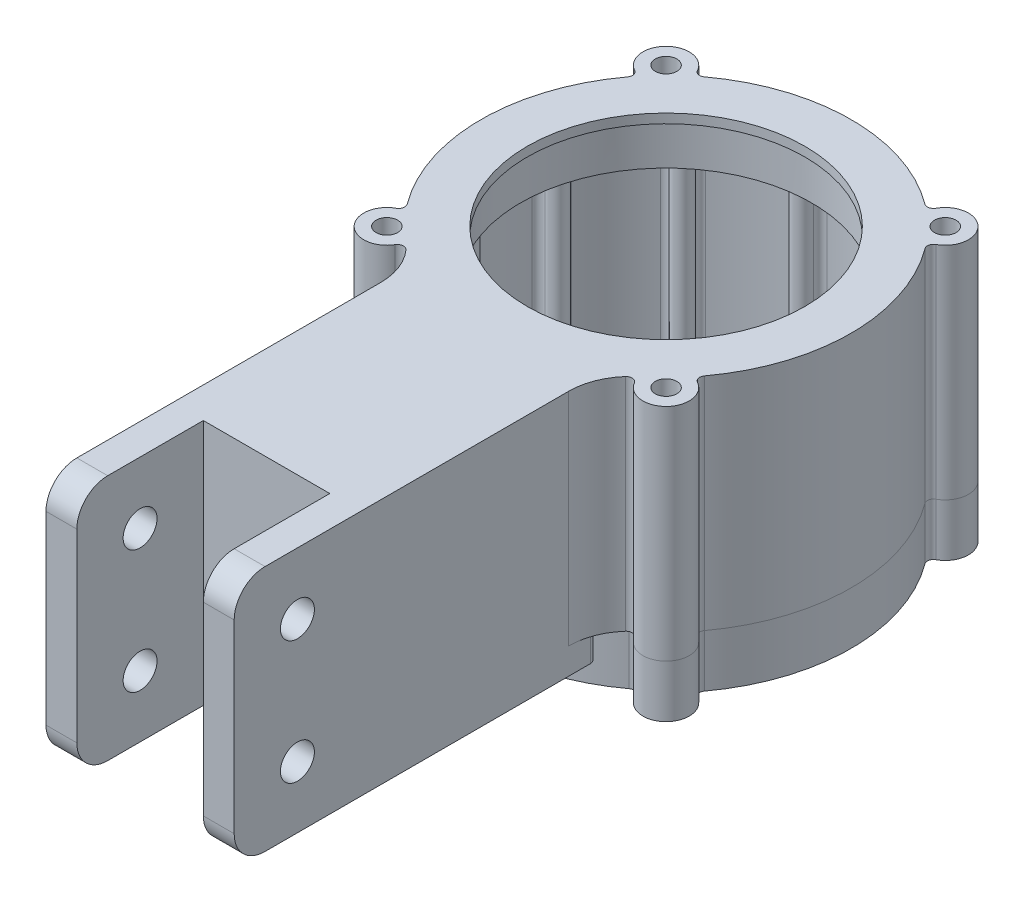
from build123d import *

# Parameters (mm, degrees)
BOSS_EXTRUDE1_DEPTH      = 13.625
BOSS_EXTRUDE2_START      = 8.5
SKETCH2_R                = 30
SKETCH2_R_2              = 22.5
BOSS_EXTRUDE2_DEPTH      = 8.5
CIRPATTERN1_COUNT        = 11
CUT_EXTRUDE1_START       = 1.5
SKETCH3_R                = 23.6
CUT_EXTRUDE1_DEPTH       = 54.980289293
BOSS_EXTRUDE3_DEPTH      = 40
FILLET1_R                = 10
FILLET2_R                = 1
CUT_EXTRUDE2_DEPTH       = 100.018385288
CUT_EXTRUDE2_DEPTH_BACK  = 100.018385288
SKETCH5_R                = 2.75
FILLET3_R                = 5
BOSS_EXTRUDE4_START      = -35.75
SKETCH6_R                = 1.75
SKETCH6_R_2              = 27.462630885
BOSS_EXTRUDE4_DEPTH      = 35.75
SKETCH7_R                = 1.75
SKETCH7_R_2              = 23.6
BOSS_EXTRUDE5_DEPTH      = 8.5
BOSS_EXTRUDE6_START      = -1.5
SKETCH8_R                = 23.6
SKETCH8_R_2              = 22.5
BOSS_EXTRUDE6_DEPTH      = 1.5
BOSS_EXTRUDE7_DEPTH      = 2.85598
BOSS_EXTRUDE7_DEPTH_BACK = 2
SKETCH9_R                = 5
SKETCH9_R_2              = 2.35
SKETCH10_R               = 2.35
CUT_EXTRUDE3_DEPTH       = 4
SKETCH11_R               = 5
BOSS_EXTRUDE8_DEPTH      = 0.85598
CHAMFER1_SIZE            = 6
SKETCH12_R               = 5.5
CUT_EXTRUDE4_DEPTH       = 3.75
CUT_EXTRUDE5_START       = -3
CUT_EXTRUDE5_DEPTH       = 3


with BuildPart() as part:
    # Sketch1 → Boss-Extrude1 (new, symmetric)
    with BuildSketch(Plane(origin=(0, 0, 0), x_dir=(1, 0, 0), z_dir=(0, 1, 0))):
        with BuildLine():
            Line((26.350201371, 7.737117217), (28.784789208, 8.451976705))
            ThreePointArc((28.784789208, 8.451976705), (30, 0), (28.784789208, -8.451976705))
            Line((28.784789208, -8.451976705), (26.350201371, -7.737117217))
            ThreePointArc((26.350201371, -7.737117217), (26.970240942, -5.177083988), (27.34216806, -2.569424229))
            ThreePointArc((27.34216806, -2.569424229), (27.037439323, -1.752898655), (26.207932692, -1.48551809))
            ThreePointArc((26.207932692, -1.48551809), (24.5, 0), (26.207932692, 1.48551809))
            ThreePointArc((26.207932692, 1.48551809), (27.037439323, 1.752898655), (27.34216806, 2.569424229))
            ThreePointArc((27.34216806, 2.569424229), (26.970240942, 5.177083988), (26.350201371, 7.737117217))
        make_face()
    extrude(amount=BOSS_EXTRUDE1_DEPTH, both=True)

    # Sketch2 → Boss-Extrude2 (add)
    with BuildSketch(Plane(origin=(0, 13.625, 0), x_dir=(1, 0, 0), z_dir=(0, 1, 0)).offset(BOSS_EXTRUDE2_START)):
        with Locations(Location((0, 0, 0), (0, 0, 16.363636364))):
            Circle(SKETCH2_R)
        with Locations(Location((0, 0, 0), (0, 0, 270))):
            Circle(SKETCH2_R_2, mode=Mode.SUBTRACT)
    extrude(amount=-BOSS_EXTRUDE2_DEPTH)

    # CirPattern1: part ×11 about axis
    cirpattern1_axis = Axis((0, 0, 0), (0, 1, 0))


with BuildPart() as part_1:
    add(part.part)
    for i in range(1, CIRPATTERN1_COUNT):
        add(part.part.rotate(cirpattern1_axis, i * 360 / CIRPATTERN1_COUNT))

    # Sketch3 → Cut-Extrude1 (cut, through all)
    with BuildSketch(Plane(origin=(0, 22.125, 0), x_dir=(-1, 0, 0), z_dir=(0, -1, 0)).offset(CUT_EXTRUDE1_START)):
        with Locations(Location((0, 0, 0), (0, 0, 270))):
            Circle(SKETCH3_R)
    extrude(amount=CUT_EXTRUDE1_DEPTH, mode=Mode.SUBTRACT)

    # Sketch4 → Boss-Extrude3 (add)
    with BuildSketch(Plane(origin=(0, 22.125, 0), x_dir=(1, 0, 0), z_dir=(0, 1, 0))):
        with BuildLine():
            Line((-10.25, -85.25), (-10.25, -64.75))
            Line((-10.25, -64.75), (10.25, -64.75))
            Line((10.25, -64.75), (10.25, -85.25))
            Line((10.25, -85.25), (15.25, -85.25))
            Line((15.25, -85.25), (15.25, -25.834811786))
            ThreePointArc((15.25, -25.834811786), (0, -30), (-15.25, -25.834811786))
            Line((-15.25, -25.834811786), (-15.25, -85.25))
            Line((-15.25, -85.25), (-10.25, -85.25))
        make_face()
    extrude(amount=-BOSS_EXTRUDE3_DEPTH)

    # Fillet1
    fillet1_edges = [part_1.edges().sort_by_distance(p)[0] for p in [
        (-15.25, 4.25, 25.834811786),
        (15.25, 4.25, 25.834811786),
    ]]
    fillet(fillet1_edges, radius=FILLET1_R)

    # Fillet2
    fillet2_edges = [part_1.edges().sort_by_distance(p)[0] for p in [
        (-15.25, -15.75, 25.834811786),
        (15.25, -15.75, 25.834811786),
    ]]
    fillet(fillet2_edges, radius=FILLET2_R)

    # Sketch5 → Cut-Extrude2 (cut, two sides: drawn at the far end of the back side and taken through both)
    with BuildSketch(Plane(origin=(15.25, 0, 0), x_dir=(0, 0, -1), z_dir=(1, 0, 0)).offset(-CUT_EXTRUDE2_DEPTH_BACK)):
        with Locations((-75, 12.125)):
            Circle(SKETCH5_R)
        with Locations((-75, -7.875)):
            Circle(SKETCH5_R)
    extrude(amount=CUT_EXTRUDE2_DEPTH + CUT_EXTRUDE2_DEPTH_BACK, mode=Mode.SUBTRACT)

    # Fillet3
    fillet3_edges = [part_1.edges().sort_by_distance(p)[0] for p in [
        (-12.75, -17.875, 85.25),
        (12.75, -17.875, 85.25),
        (-12.75, 22.125, 85.25),
        (12.75, 22.125, 85.25),
    ]]
    fillet(fillet3_edges, radius=FILLET3_R)

    # Sketch6 → Boss-Extrude4 (add)
    with BuildSketch(Plane.XZ.offset(13.625).offset(BOSS_EXTRUDE4_START)):
        with BuildLine():
            Line((-15.25, 31.02317682), (15.25, 31.02317682))
            ThreePointArc((15.25, 31.02317682), (15.905414091, 27.462458609), (17.785742836, 24.368489375))
            ThreePointArc((17.785742836, 24.368489375), (18.630428865, 24.038797373), (19.39432612, 24.527317883))
            ThreePointArc((19.39432612, 24.527317883), (25.320103508, 25.237386224), (24.42555064, 19.336639673))
            ThreePointArc((24.42555064, 19.336639673), (23.928384484, 18.673851742), (24.10166414, 17.863644244))
            ThreePointArc((24.10166414, 17.863644244), (30, 0), (24.10166414, -17.863644244))
            ThreePointArc((24.10166414, -17.863644244), (23.928384484, -18.673851742), (24.42555064, -19.336639673))
            ThreePointArc((24.42555064, -19.336639673), (25.279067427, -25.279067427), (19.336639673, -24.42555064))
            ThreePointArc((19.336639673, -24.42555064), (18.673851742, -23.928384484), (17.863644244, -24.10166414))
            ThreePointArc((17.863644244, -24.10166414), (0, -30), (-17.863644244, -24.10166414))
            ThreePointArc((-17.863644244, -24.10166414), (-18.673851742, -23.928384484), (-19.336639673, -24.42555064))
            ThreePointArc((-19.336639673, -24.42555064), (-25.279067427, -25.279067427), (-24.42555064, -19.336639673))
            ThreePointArc((-24.42555064, -19.336639673), (-23.928384484, -18.673851742), (-24.10166414, -17.863644244))
            ThreePointArc((-24.10166414, -17.863644244), (-30, 0), (-24.10166414, 17.863644244))
            ThreePointArc((-24.10166414, 17.863644244), (-23.928384484, 18.673851742), (-24.42555064, 19.336639673))
            ThreePointArc((-24.42555064, 19.336639673), (-25.320103508, 25.237386224), (-19.39432612, 24.527317883))
            ThreePointArc((-19.39432612, 24.527317883), (-18.630428865, 24.038797373), (-17.785742836, 24.368489375))
            ThreePointArc((-17.785742836, 24.368489375), (-15.905414091, 27.462458609), (-15.25, 31.02317682))
        make_face()
        with Locations(Location((22.627416998, 22.627416998, 0), (0, 0, 270))):
            Circle(SKETCH6_R, mode=Mode.SUBTRACT)
        with Locations(Location((22.627416998, -22.627416998, 0), (0, 0, 270))):
            Circle(SKETCH6_R, mode=Mode.SUBTRACT)
        with Locations(Location((-22.627416998, -22.627416998, 0), (0, 0, 270))):
            Circle(SKETCH6_R, mode=Mode.SUBTRACT)
        with Locations(Location((-22.627416998, 22.627416998, 0), (0, 0, 270))):
            Circle(SKETCH6_R, mode=Mode.SUBTRACT)
        Circle(SKETCH6_R_2, mode=Mode.SUBTRACT)
    extrude(amount=BOSS_EXTRUDE4_DEPTH)

    # Sketch12 → Cut-Extrude4 (cut)
    with BuildSketch(Plane.XZ.offset(17.875)):
        with Locations((-12.473575752, 27.290998352)):
            Circle(SKETCH12_R)
    extrude(amount=-CUT_EXTRUDE4_DEPTH, mode=Mode.SUBTRACT)


with BuildPart() as body_2:
    # Sketch7 → Boss-Extrude5 (new body)
    with BuildSketch(Plane.XZ.offset(13.625)):
        with BuildLine():
            ThreePointArc((-19.162987626, 24.062766826), (-25.133051615, 25.417451974), (-24.42555064, 19.336639673))
            ThreePointArc((-24.42555064, 19.336639673), (-23.928384484, 18.673851742), (-24.10166414, 17.863644244))
            ThreePointArc((-24.10166414, 17.863644244), (-30, 0), (-24.10166414, -17.863644244))
            ThreePointArc((-24.10166414, -17.863644244), (-23.928384484, -18.673851742), (-24.42555064, -19.336639673))
            ThreePointArc((-24.42555064, -19.336639673), (-25.279067427, -25.279067427), (-19.336639673, -24.42555064))
            ThreePointArc((-19.336639673, -24.42555064), (-18.673851742, -23.928384484), (-17.863644244, -24.10166414))
            ThreePointArc((-17.863644244, -24.10166414), (0, -30), (17.863644244, -24.10166414))
            ThreePointArc((17.863644244, -24.10166414), (18.673851742, -23.928384484), (19.336639673, -24.42555064))
            ThreePointArc((19.336639673, -24.42555064), (25.279067427, -25.279067427), (24.42555064, -19.336639673))
            ThreePointArc((24.42555064, -19.336639673), (23.928384484, -18.673851742), (24.10166414, -17.863644244))
            ThreePointArc((24.10166414, -17.863644244), (30, 0), (24.10166414, 17.863644244))
            ThreePointArc((24.10166414, 17.863644244), (23.928384484, 18.673851742), (24.42555064, 19.336639673))
            ThreePointArc((24.42555064, 19.336639673), (25.133051615, 25.417451974), (19.162987626, 24.062766826))
            ThreePointArc((19.162987626, 24.062766826), (18.504427807, 23.481357568), (17.641135211, 23.644034099))
            ThreePointArc((17.641135211, 23.644034099), (0, 29.5), (-17.641135211, 23.644034099))
            ThreePointArc((-17.641135211, 23.644034099), (-18.504427807, 23.481357568), (-19.162987626, 24.062766826))
        make_face()
        with Locations(Location((-22.627416998, 22.627416998, 0), (0, 0, 270))):
            Circle(SKETCH7_R, mode=Mode.SUBTRACT)
        with Locations(Location((-22.627416998, -22.627416998, 0), (0, 0, 270))):
            Circle(SKETCH7_R, mode=Mode.SUBTRACT)
        with Locations(Location((22.627416998, -22.627416998, 0), (0, 0, 270))):
            Circle(SKETCH7_R, mode=Mode.SUBTRACT)
        with Locations(Location((22.627416998, 22.627416998, 0), (0, 0, 270))):
            Circle(SKETCH7_R, mode=Mode.SUBTRACT)
        with Locations(Location((0, 0, 0), (0, 0, 270))):
            Circle(SKETCH7_R_2, mode=Mode.SUBTRACT)
    extrude(amount=BOSS_EXTRUDE5_DEPTH)

    # Sketch8 → Boss-Extrude6 (add)
    with BuildSketch(Plane.XZ.offset(22.125).offset(BOSS_EXTRUDE6_START)):
        with Locations(Location((0, 0, 0), (0, 0, 270))):
            Circle(SKETCH8_R)
        with Locations(Location((0, 0, 0), (0, 0, 270))):
            Circle(SKETCH8_R_2, mode=Mode.SUBTRACT)
    extrude(amount=BOSS_EXTRUDE6_DEPTH)

    # Sketch9 → Boss-Extrude7 (add, two sides: drawn at the far end of the back side and taken through both)
    # profile 1 of 2: a face of its own
    with BuildSketch(Plane.XZ.offset(22.125).offset(-BOSS_EXTRUDE7_DEPTH_BACK)):
        with Locations(Location((-12.473575752, 27.290998352, 0), (0, 0, 270))):
            Circle(SKETCH9_R)
        with Locations(Location((-12.473575752, 27.290998352, 0), (0, 0, 270))):
            Circle(SKETCH9_R_2, mode=Mode.SUBTRACT)
    # profile 2 of 2: a face of its own
    with BuildSketch(Plane.XZ.offset(22.125).offset(-BOSS_EXTRUDE7_DEPTH_BACK)):
        with Locations(Location((-27.290998352, 12.473575752, 0), (0, 0, 270))):
            Circle(SKETCH9_R)
        with Locations(Location((-27.290998352, 12.473575752, 0), (0, 0, 270))):
            Circle(SKETCH9_R_2, mode=Mode.SUBTRACT)
    extrude(amount=BOSS_EXTRUDE7_DEPTH + BOSS_EXTRUDE7_DEPTH_BACK)

    # Sketch10 → Cut-Extrude3 (cut)
    with BuildSketch(Plane.XZ.offset(24.98098)):
        with Locations(Location((-27.290998352, 12.473575752, 0), (0, 0, 270))):
            Circle(SKETCH10_R)
        with Locations(Location((-12.473575752, 27.290998352, 0), (0, 0, 270))):
            Circle(SKETCH10_R)
    extrude(amount=-CUT_EXTRUDE3_DEPTH, mode=Mode.SUBTRACT)

    # Sketch11 → Boss-Extrude8 (add)
    with BuildSketch(Plane(origin=(0, -20.125, 0), x_dir=(1, 0, 0), z_dir=(0, 1, 0))):
        with Locations(Location((-27.290998352, -12.473575752, 0), (0, 0, 90))):
            Circle(SKETCH11_R)
        with Locations(Location((-12.473575752, -27.290998352, 0), (0, 0, 90))):
            Circle(SKETCH11_R)
    extrude(amount=-BOSS_EXTRUDE8_DEPTH)

    # Chamfer1
    # the kernel refuses this chamfer: 6 mm, written as the material it adds along each edge
    with BuildSketch(Plane(origin=(0, -20.125, 0), x_dir=(-0.9392480343191701, 0, 0.34323917321246267), z_dir=(-0.34323917321246267, 0, -0.9392480343191701))) as chamfer1_piece_1_section:
        Polygon((30, CHAMFER1_SIZE), (30 + CHAMFER1_SIZE, 0), (30, 0), align=None)
    chamfer1_piece_1 = revolve(axis=Axis((0, -20.125, 0), (0, 1, 0)), revolution_arc=8.977631612, mode=Mode.PRIVATE)
    chamfer1_piece_1 = chamfer1_piece_1 & Plane(origin=(-27.290998352, -18.078063928, 12.473575752), x_dir=(0, 0, -1), z_dir=(0, -1, 0)) * Cylinder(5, 145, mode=Mode.PRIVATE)
    add(chamfer1_piece_1)
    with BuildSketch(Plane(origin=(0, -20.125, 0), x_dir=(-0.48455709013511117, 0, 0.8747596392151353), z_dir=(-0.8747596392151353, 0, -0.48455709013511117))) as chamfer1_piece_2_section:
        Polygon((29.5, CHAMFER1_SIZE), (29.5 + CHAMFER1_SIZE, 0), (29.5, 0), align=None)
    chamfer1_piece_2 = revolve(axis=Axis((0, -20.125, 0), (0, 1, 0)), revolution_arc=8.840594145, mode=Mode.PRIVATE)
    chamfer1_piece_2 = chamfer1_piece_2 & Plane(origin=(-12.473575752, -18.13404407, 27.290998352), x_dir=(0, 0, -1), z_dir=(0, -1, 0)) * Cylinder(5, 143, mode=Mode.PRIVATE)
    add(chamfer1_piece_2)
    with BuildSketch(Plane(origin=(0, -20.125, 0), x_dir=(-0.8997292841736524, 0, 0.4364484106974925), z_dir=(-0.4364484106974925, 0, -0.8997292841736524))) as chamfer1_piece_3_section:
        Polygon((29.5, CHAMFER1_SIZE), (29.5 + CHAMFER1_SIZE, 0), (29.5, 0), align=None)
    chamfer1_piece_3 = revolve(axis=Axis((0, -20.125, 0), (0, 1, 0)), revolution_arc=35.139047398, mode=Mode.PRIVATE)
    chamfer1_piece_3 = chamfer1_piece_3 & Plane(origin=(-27.290998352, -17.994302416, 12.473575752), x_dir=(0, 0, -1), z_dir=(0, -1, 0)) * Cylinder(5, 143, mode=Mode.PRIVATE)
    add(chamfer1_piece_3)
    with BuildSketch(Plane(origin=(0, -20.125, 0), x_dir=(-0.8997292841736524, 0, 0.4364484106974925), z_dir=(-0.4364484106974925, 0, -0.8997292841736524))) as chamfer1_piece_4_section:
        Polygon((29.5, CHAMFER1_SIZE), (29.5 + CHAMFER1_SIZE, 0), (29.5, 0), align=None)
    chamfer1_piece_4 = revolve(axis=Axis((0, -20.125, 0), (0, 1, 0)), revolution_arc=35.139047398, mode=Mode.PRIVATE)
    chamfer1_piece_4 = chamfer1_piece_4 & Plane(origin=(-12.473575752, -17.893695183, 27.290998352), x_dir=(0, 0, -1), z_dir=(0, -1, 0)) * Cylinder(5, 143, mode=Mode.PRIVATE)
    add(chamfer1_piece_4)
    with BuildSketch(Plane(origin=(0, -20.125, 0), x_dir=(-0.34436215309681095, 0, 0.9388368907933521), z_dir=(-0.9388368907933521, 0, -0.34436215309681095))) as chamfer1_piece_5_section:
        Polygon((29.5, CHAMFER1_SIZE), (29.5 + CHAMFER1_SIZE, 0), (29.5, 0), align=None)
    chamfer1_piece_5 = revolve(axis=Axis((0, -20.125, 0), (0, 1, 0)), revolution_arc=35.139047398, mode=Mode.PRIVATE)
    chamfer1_piece_5 = chamfer1_piece_5 & Plane(origin=(-12.473575752, -17.893695362, 27.290998352), x_dir=(0, 0, -1), z_dir=(0, -1, 0)) * Cylinder(5, 143, mode=Mode.PRIVATE)
    add(chamfer1_piece_5)
    with BuildSketch(Plane(origin=(0, -20.125, 0), x_dir=(-0.9682980800313526, 0, -0.24979757446299614), z_dir=(0.24979757446299614, 0, -0.9682980800313526))) as chamfer1_piece_6_section:
        Polygon((30, CHAMFER1_SIZE), (30 + CHAMFER1_SIZE, 0), (30, 0), align=None)
    chamfer1_piece_6 = revolve(axis=Axis((0, -20.125, 0), (0, 1, 0)), revolution_arc=34.539879371, mode=Mode.PRIVATE)
    chamfer1_piece_6 = chamfer1_piece_6 & Plane(origin=(-27.290998352, -17.811897286, 12.473575752), x_dir=(0, 0, -1), z_dir=(0, -1, 0)) * Cylinder(5, 144, mode=Mode.PRIVATE)
    add(chamfer1_piece_6)
    with BuildSketch(Plane(origin=(0, -20.125, 0), x_dir=(-0.8741795429258731, 0, 0.4856028487662645), z_dir=(-0.4856028487662645, 0, -0.8741795429258731))) as chamfer1_piece_7_section:
        Polygon((30, CHAMFER1_SIZE), (30 + CHAMFER1_SIZE, 0), (30, 0), align=None)
    chamfer1_piece_7 = revolve(axis=Axis((0, -20.125, 0), (0, 1, 0)), revolution_arc=34.539879371, mode=Mode.PRIVATE)
    chamfer1_piece_7 = chamfer1_piece_7 & Plane(origin=(-27.290998352, -17.811897284, 12.473575752), x_dir=(0, 0, -1), z_dir=(0, -1, 0)) * Cylinder(5, 144, mode=Mode.PRIVATE)
    add(chamfer1_piece_7)

    # Sketch13 → Cut-Extrude5 (cut)
    with BuildSketch(Plane.XZ.offset(22.125).offset(CUT_EXTRUDE5_START)):
        with BuildLine():
            Line((-24.82561255, 16.843068649), (-30.332153931, 20.579010886))
            Line((-30.332153931, 20.579010886), (-20.298293076, 29.918393722))
            Line((-20.298293076, 29.918393722), (-16.562350838, 24.411852341))
            ThreePointArc((-16.562350838, 24.411852341), (-17.559603784, 23.704647539), (-18.526698158, 22.956730067))
            ThreePointArc((-18.526698158, 22.956730067), (-18.77949023, 22.65199505), (-18.89419923, 22.273037127))
            ThreePointArc((-18.89419923, 22.273037127), (-20.164129593, 19.799924264), (-22.787928321, 18.880853757))
            ThreePointArc((-22.787928321, 18.880853757), (-23.24921369, 18.789995157), (-23.617997939, 18.498382993))
            ThreePointArc((-23.617997939, 18.498382993), (-24.235941609, 17.681038836), (-24.82561255, 16.843068649))
        make_face()
    extrude(amount=CUT_EXTRUDE5_DEPTH, mode=Mode.SUBTRACT)


solid = Compound([part_1.part, body_2.part])
